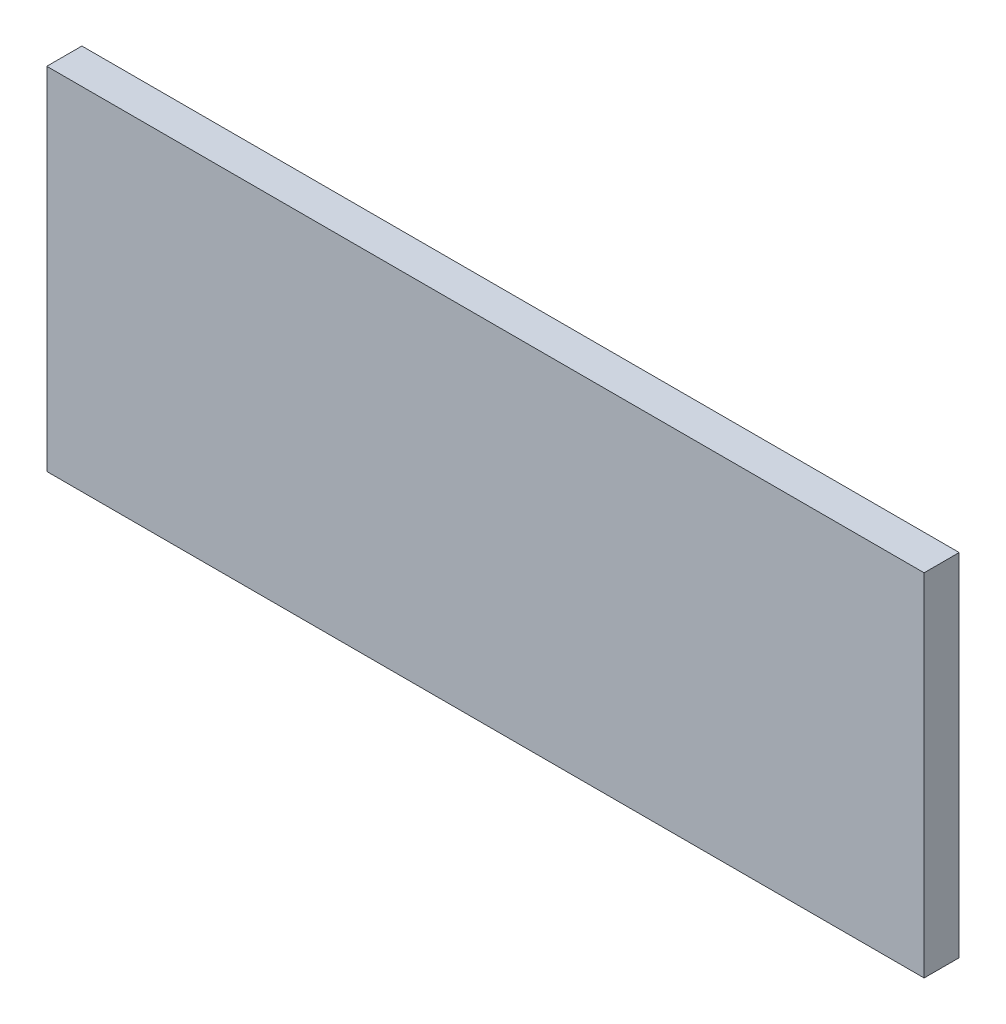
from build123d import *

# Parameters (mm, degrees)
SKETCH_1_W      = 100
SKETCH_1_H      = 40
EXTRUDE_1_DEPTH = 4


with BuildPart() as part:
    # Эскиз1 → Бобышка-Вытянуть1 (new body)
    with BuildSketch(Plane.XY):
        Rectangle(SKETCH_1_W, SKETCH_1_H)
    extrude(amount=EXTRUDE_1_DEPTH)


solid = part.part
